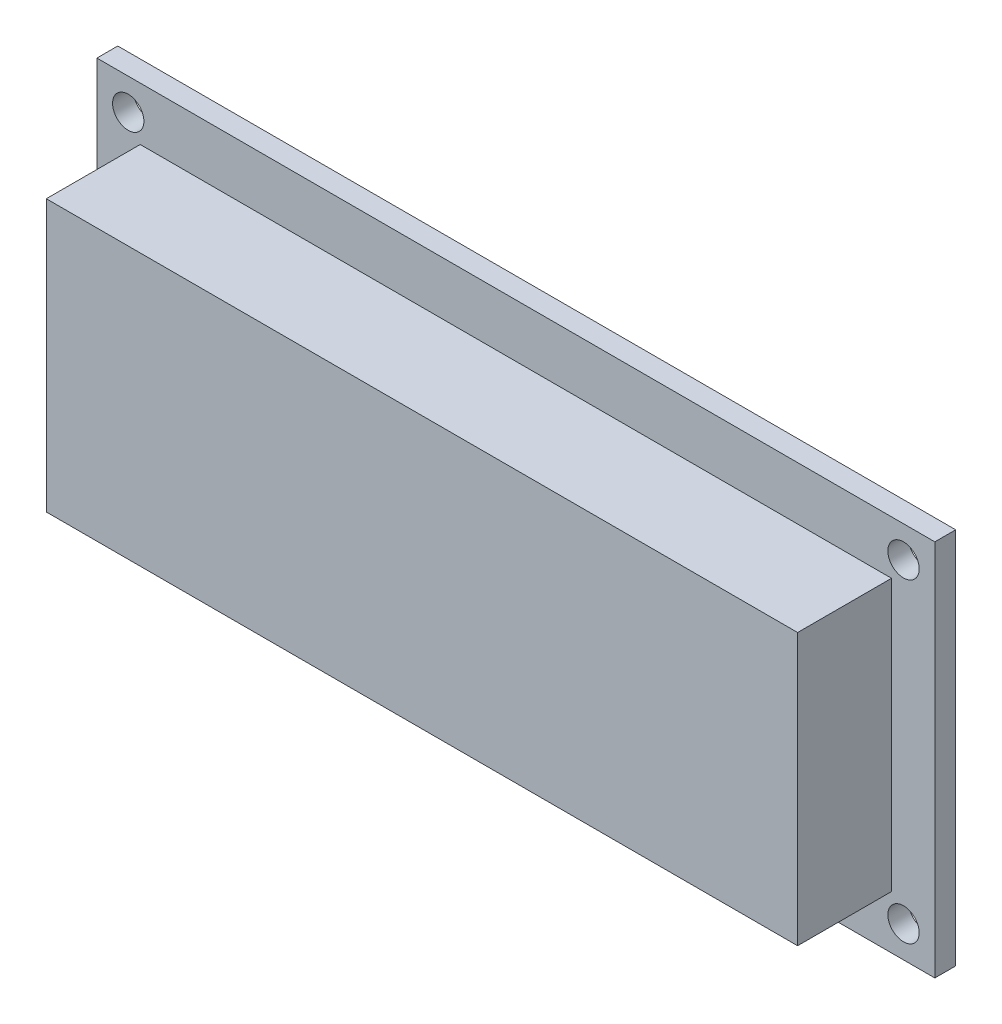
from build123d import *

# Parameters (mm, degrees)
SKETCH_1_W          = 80.3
SKETCH_1_H          = 36.2
EXTRUDE_1_DEPTH     = 2
SKETCH_2_W          = 72
SKETCH_2_H          = 26
EXTRUDE_2_DEPTH     = 9
SKETCH_3_R          = 1.5
CUT_EXTRUDE_1_DEPTH = 66.899838851


with BuildPart() as part:
    # Эскиз1 → Бобышка-Вытянуть1 (new body)
    with BuildSketch(Plane.XY):
        with Locations((21.104780468, -4.475221601)):
            Rectangle(SKETCH_1_W, SKETCH_1_H)
    extrude(amount=EXTRUDE_1_DEPTH)

    # Эскиз2 → Бобышка-Вытянуть2 (add)
    with BuildSketch(Plane.XY.offset(2)):
        with Locations((21.104780468, -4.475221601)):
            Rectangle(SKETCH_2_W, SKETCH_2_H)
    extrude(amount=EXTRUDE_2_DEPTH)

    # Эскиз3 → Вырез-Вытянуть1 (cut, through all)
    with BuildSketch(Plane.XY.offset(2)):
        with Locations((-16.045219532, 10.624778399)):
            Circle(SKETCH_3_R)
        with Locations((58.254780468, 10.624778399)):
            Circle(SKETCH_3_R)
        with Locations((58.254780468, -19.575221601)):
            Circle(SKETCH_3_R)
        with Locations((-16.045219532, -19.575221601)):
            Circle(SKETCH_3_R)
    extrude(amount=-CUT_EXTRUDE_1_DEPTH, mode=Mode.SUBTRACT)


solid = part.part
